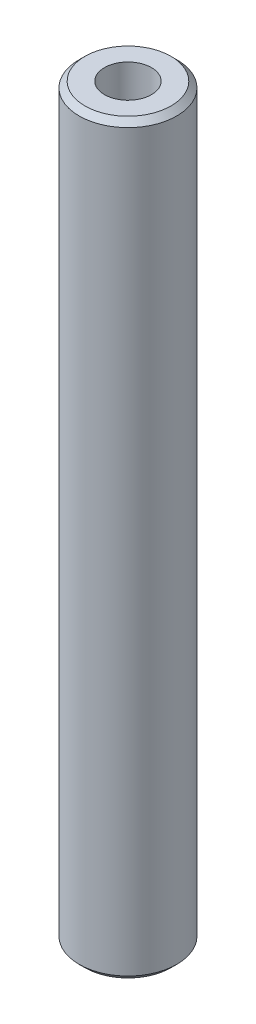
from build123d import *

# Parameters (mm, degrees)
SKETCH1_R           = 22.5
BOSS_EXTRUDE1_DEPTH = 344.01880965
SKETCH2_R           = 10.821549768
CUT_EXTRUDE1_DEPTH  = 346.487252142
CHAMFER1_SIZE       = 2.66786582


with BuildPart() as part:
    # Sketch1 → Boss-Extrude1 (new body)
    with BuildSketch(Plane(origin=(0, 0, 0), x_dir=(1, 0, 0), z_dir=(0, 1, 0))):
        Circle(SKETCH1_R)
    extrude(amount=BOSS_EXTRUDE1_DEPTH)

    # Sketch2 → Cut-Extrude1 (cut, through all)
    with BuildSketch(Plane(origin=(0, 0, 0), x_dir=(1, 0, 0), z_dir=(0, 1, 0))):
        Circle(SKETCH2_R)
    extrude(amount=CUT_EXTRUDE1_DEPTH, mode=Mode.SUBTRACT)

    # Chamfer1
    chamfer1_edges = [part.edges().sort_by_distance(p)[0] for p in [
        (-22.5, 344.01880965, 0),
        (-22.5, 0, 0),
    ]]
    chamfer(chamfer1_edges, length=CHAMFER1_SIZE)


solid = part.part
